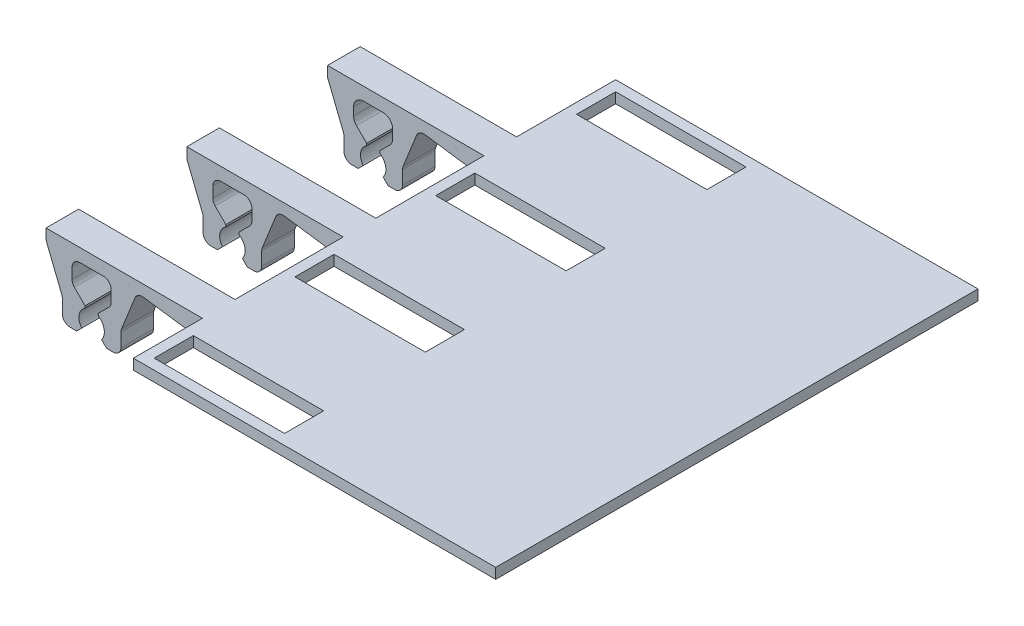
from build123d import *

# Parameters (mm, degrees)
SKETCH1_W                    = 55.6
SKETCH1_H                    = 74
PLATE_DEPTH                  = 1.6
SKETCH5_W                    = 20
SKETCH5_H                    = 6
AIR_WINDOW_DEPTH             = 1.6
WINDOWS_COUNT                = 4
WINDOWS_PITCH                = 21.6
CLIPS_DEPTH                  = 5
CLIP_CUT1_DEPTH              = 76.317610822
SKETCH8_R                    = 1.95
CLIP_CUT2_DEPTH              = 76.317610822
FILLET1_R                    = 1.2
CHAMFER1_SIZE                = 0.921400886
CHAMFER1_SIZE_2              = 0.8
LPATTERN2_COUNT              = 3
LPATTERN2_PITCH              = 21.6
FILLET1_OF_LPATTERN2_R       = 1.2
CHAMFER1_OF_LPATTERN2_SIZE   = 0.921400886
CHAMFER1_OF_LPATTERN2_SIZE_2 = 0.8
FILLET3_R                    = 1.5


with BuildPart() as part:
    # Sketch1 → plate (new body)
    with BuildSketch(Plane(origin=(0, 0, 0), x_dir=(1, 0, 0), z_dir=(0, 1, 0))):
        Rectangle(SKETCH1_W, SKETCH1_H)
    extrude(amount=PLATE_DEPTH)

    # Sketch5 → air window (cut)
    with BuildSketch(Plane(origin=(0, 1.6, 0), x_dir=(1, 0, 0), z_dir=(0, 1, 0))):
        with Locations((-16.2, 32.4)):
            Rectangle(SKETCH5_W, SKETCH5_H)
    air_window = extrude(amount=-AIR_WINDOW_DEPTH, mode=Mode.SUBTRACT)

    # windows: air window ×4
    with Locations(*[(0, 0, i * WINDOWS_PITCH) for i in range(1, WINDOWS_COUNT)]):
        add(air_window, mode=Mode.SUBTRACT)

    # Sketch6 → clips (add)
    with BuildSketch(Plane.XY.offset(-16.8)):
        Polygon((-37.8, 0), (-40.3, -6.25), (-40.3, -9.75), (-49.3, -9.75), (-49.3, -6.25), (-51.8, 0), (-51.8, 1.6), (-37.8, 1.6), (-17.8, 1.6), (-17.8, 0), (-27.8, -1.4), align=None)
        Polygon((6.2, 0), (20.2, 0), (17.7, -6.25), (17.7, -9.75), (8.7, -9.75), (8.7, -6.25), align=None)
    clips = extrude(amount=-CLIPS_DEPTH)

    # Sketch7 → clip cut1 (cut, through all)
    with BuildSketch(Plane.XY.offset(-16.8)):
        Polygon((-46.3, -9.75), (-43.3, -9.75), (-43.8, -5.75), (-41.8, -3.75), (-41.8, -0.4), (-47.8, -0.4), (-47.8, -3.75), (-45.8, -5.75), align=None)
        Polygon((12.2, -5.75), (11.7, -9.75), (14.7, -9.75), (14.2, -5.75), (16.2, -3.75), (16.2, 0), (10.2, 0), (10.2, -3.75), align=None)
    clip_cut1 = extrude(amount=-CLIP_CUT1_DEPTH, mode=Mode.SUBTRACT)

    # Sketch8 → clip cut2 (cut, through all)
    with BuildSketch(Plane.XY.offset(-16.8)):
        with Locations((-44.8, -7.75)):
            Circle(SKETCH8_R)
        with Locations((13.2, -8)):
            Circle(SKETCH8_R)
    clip_cut2 = extrude(amount=-CLIP_CUT2_DEPTH, mode=Mode.SUBTRACT)

    # Fillet1
    fillet1_edges = [part.edges().sort_by_distance(p)[0] for p in [
        (-47.8, -3.75, -19.3),
        (-47.8, -0.4, -19.3),
        (-41.8, -0.4, -19.3),
        (-41.8, -3.75, -19.3),
        (10.2, -3.75, -19.3),
        (10.2, 0, -19.3),
        (16.2, 0, -19.3),
        (16.2, -3.75, -19.3),
        (-37.8, 0, -19.3),
        (-40.3, -6.25, -19.3),
        (-40.3, -9.75, -19.3),
        (-49.3, -9.75, -19.3),
        (-49.3, -6.25, -19.3),
        (-51.8, 0, -19.3),
        (8.7, -6.25, -19.3),
        (6.2, 0, -19.3),
        (20.2, 0, -19.3),
        (17.7, -6.25, -19.3),
        (17.7, -9.75, -19.3),
        (8.7, -9.75, -19.3),
    ]]
    fillet(fillet1_edges, radius=FILLET1_R)

    # Chamfer1
    # the kernel refuses this chamfer: 0.921400886, 0.8 mm, written as the material it takes off along each edge
    with BuildSketch(Plane(origin=(-46.3, -9.75, -14.423093564), x_dir=(0.1476150519858161, 0.9890448910070891, 0), z_dir=(0, 0, -1))) as chamfer1_piece_1:
        Polygon((CHAMFER1_SIZE * 0.999716757696, -CHAMFER1_SIZE * 0.0237992297902), (-CHAMFER1_SIZE_2 * 0.147615051986, -CHAMFER1_SIZE_2 * 0.989044891007), (0, 0), align=None)
    extrude(amount=9.753812872, mode=Mode.SUBTRACT)
    with BuildSketch(Plane(origin=(-43.3, -9.75, -14.423093564), x_dir=(-0.14761505198581634, 0.989044891007089, 0), z_dir=(0, 0, -1)), Plane(origin=(11.7, -9.75, -14.423093564), x_dir=(-0.9997167582174482, -0.023799229802586665, 0), z_dir=(0, 0, -1))) as chamfer1_piece_2:
        Polygon((CHAMFER1_SIZE * 0.999716757696, CHAMFER1_SIZE * 0.0237992297902), (-CHAMFER1_SIZE_2 * 0.147615051986, CHAMFER1_SIZE_2 * 0.989044891007), (0, 0), align=None)
    extrude(amount=9.753812872, mode=Mode.SUBTRACT)
    with BuildSketch(Plane(origin=(14.7, -9.75, -14.423093564), x_dir=(0.9995027110658466, -0.03153300765899949, 0), z_dir=(0, 0, -1))) as chamfer1_piece_3:
        Polygon((CHAMFER1_SIZE_2 * 0.999502711066, -CHAMFER1_SIZE_2 * 0.031533007659), (-CHAMFER1_SIZE * 0.155262559294, -CHAMFER1_SIZE * 0.987873239155), (0, 0), align=None)
    extrude(amount=9.753812872, mode=Mode.SUBTRACT)

    # LPattern2: clips, clip cut1, clip cut2 ×3
    with Locations(*[(0, 0, i * LPATTERN2_PITCH) for i in range(1, LPATTERN2_COUNT)]):
        add(clips)
        add(clip_cut1, mode=Mode.SUBTRACT)
        add(clip_cut2, mode=Mode.SUBTRACT)

    # Fillet1 of LPattern2
    fillet1_of_lpattern2_edges = [part.edges().sort_by_distance(p)[0] for p in [
        (-47.8, -3.75, 2.3),
        (-47.8, -0.4, 2.3),
        (-41.8, -0.4, 2.3),
        (-41.8, -3.75, 2.3),
        (10.2, -3.75, 2.3),
        (10.2, 0, 2.3),
        (16.2, 0, 2.3),
        (16.2, -3.75, 2.3),
        (-37.8, 0, 2.3),
        (-40.3, -6.25, 2.3),
        (-40.3, -9.75, 2.3),
        (-49.3, -9.75, 2.3),
        (-49.3, -6.25, 2.3),
        (-51.8, 0, 2.3),
        (8.7, -6.25, 2.3),
        (6.2, 0, 2.3),
        (20.2, 0, 2.3),
        (17.7, -6.25, 2.3),
        (17.7, -9.75, 2.3),
        (8.7, -9.75, 2.3),
        (-47.8, -3.75, 23.9),
        (-47.8, -0.4, 23.9),
        (-41.8, -0.4, 23.9),
        (-41.8, -3.75, 23.9),
        (10.2, -3.75, 23.9),
        (10.2, 0, 23.9),
        (16.2, 0, 23.9),
        (16.2, -3.75, 23.9),
        (-37.8, 0, 23.9),
        (-40.3, -6.25, 23.9),
        (-40.3, -9.75, 23.9),
        (-49.3, -9.75, 23.9),
        (-49.3, -6.25, 23.9),
        (-51.8, 0, 23.9),
        (8.7, -6.25, 23.9),
        (6.2, 0, 23.9),
        (20.2, 0, 23.9),
        (17.7, -6.25, 23.9),
        (17.7, -9.75, 23.9),
        (8.7, -9.75, 23.9),
    ]]
    fillet(fillet1_of_lpattern2_edges, radius=FILLET1_OF_LPATTERN2_R)

    # Chamfer1 of LPattern2
    # the kernel refuses this chamfer: 0.921400886, 0.8 mm, written as the material it takes off along each edge
    with BuildSketch(Plane(origin=(-46.3, -9.75, 7.176906436), x_dir=(0.1476150519858161, 0.9890448910070891, 0), z_dir=(0, 0, -1)), Plane(origin=(-46.3, -9.75, 28.776906436), x_dir=(0.1476150519858161, 0.9890448910070891, 0), z_dir=(0, 0, -1))) as chamfer1_of_lpattern2_piece_1:
        Polygon((CHAMFER1_OF_LPATTERN2_SIZE * 0.999716757696, -CHAMFER1_OF_LPATTERN2_SIZE * 0.0237992297902), (-CHAMFER1_OF_LPATTERN2_SIZE_2 * 0.147615051986, -CHAMFER1_OF_LPATTERN2_SIZE_2 * 0.989044891007), (0, 0), align=None)
    extrude(amount=9.753812872, mode=Mode.SUBTRACT)
    with BuildSketch(Plane(origin=(-43.3, -9.75, 7.176906436), x_dir=(-0.14761505198581634, 0.989044891007089, 0), z_dir=(0, 0, -1)), Plane(origin=(11.7, -9.75, 7.176906436), x_dir=(-0.9997167582174482, -0.023799229802586665, 0), z_dir=(0, 0, -1)), Plane(origin=(-43.3, -9.75, 28.776906436), x_dir=(-0.14761505198581634, 0.989044891007089, 0), z_dir=(0, 0, -1)), Plane(origin=(11.7, -9.75, 28.776906436), x_dir=(-0.9997167582174482, -0.023799229802586665, 0), z_dir=(0, 0, -1))) as chamfer1_of_lpattern2_piece_2:
        Polygon((CHAMFER1_OF_LPATTERN2_SIZE * 0.999716757696, CHAMFER1_OF_LPATTERN2_SIZE * 0.0237992297902), (-CHAMFER1_OF_LPATTERN2_SIZE_2 * 0.147615051986, CHAMFER1_OF_LPATTERN2_SIZE_2 * 0.989044891007), (0, 0), align=None)
    extrude(amount=9.753812872, mode=Mode.SUBTRACT)
    with BuildSketch(Plane(origin=(14.7, -9.75, 7.176906436), x_dir=(0.9995027110658466, -0.03153300765899949, 0), z_dir=(0, 0, -1)), Plane(origin=(14.7, -9.75, 28.776906436), x_dir=(0.9995027110658466, -0.03153300765899949, 0), z_dir=(0, 0, -1))) as chamfer1_of_lpattern2_piece_3:
        Polygon((CHAMFER1_OF_LPATTERN2_SIZE_2 * 0.999502711066, -CHAMFER1_OF_LPATTERN2_SIZE_2 * 0.031533007659), (-CHAMFER1_OF_LPATTERN2_SIZE * 0.155262559294, -CHAMFER1_OF_LPATTERN2_SIZE * 0.987873239155), (0, 0), align=None)
    extrude(amount=9.753812872, mode=Mode.SUBTRACT)

    # Fillet3
    fillet3_edges = [part.edges().sort_by_distance(p)[0] for p in [
        (10.2, -3.75, -19.3),
        (10.2, 0, -19.3),
        (16.2, 0, -19.3),
        (16.2, -3.75, -19.3),
        (-47.8, -3.75, -19.3),
        (-47.8, -0.4, -19.3),
        (-41.8, -0.4, -19.3),
        (-41.8, -3.75, -19.3),
    ]]
    fillet(fillet3_edges, radius=FILLET3_R)


solid = part.part
